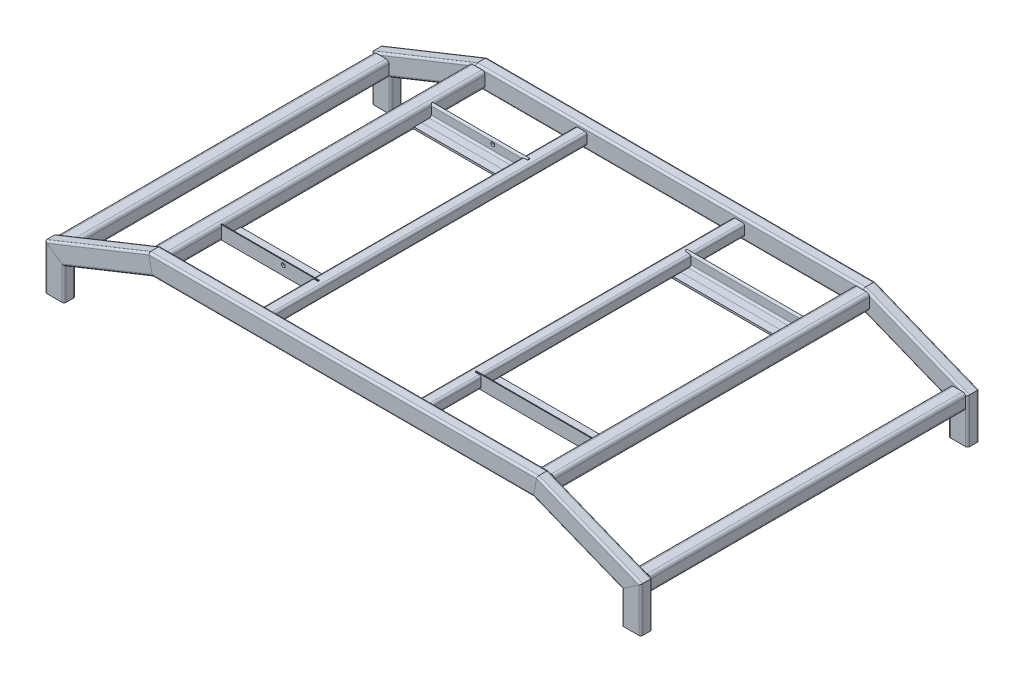
from build123d import *

# Parameters (mm, degrees)
RECTANGULAR_TUBE_CONFIGURED_50_X_30_X_DEPTH      = 120.738733147
RECTANGULAR_TUBE_CONFIGURED_50_X_3_3_DEPTH       = 296.611667158
RECTANGULAR_TUBE_CONFIGURED_50_X_3_5_DEPTH       = 1013.22938731
RECTANGULAR_TUBE_CONFIGURED_50_X_3_7_DEPTH       = 296.611667158
RECTANGULAR_TUBE_CONFIGURED_50_X_3_9_DEPTH       = 100
RECTANGULAR_TUBE_CONFIGURED_50_X_3_9_DEPTH_BACK  = 20.738733147
RECTANGULAR_TUBE_CONFIGURED_50_X_3_10_DEPTH      = 120.738733147
RECTANGULAR_TUBE_CONFIGURED_50_X_3_12_DEPTH      = 296.611667158
RECTANGULAR_TUBE_CONFIGURED_50_X_3_15_DEPTH      = 1013.22938731
RECTANGULAR_TUBE_CONFIGURED_50_X_3_18_DEPTH      = 296.611667158
RECTANGULAR_TUBE_CONFIGURED_50_X_3_21_DEPTH      = 100
RECTANGULAR_TUBE_CONFIGURED_50_X_3_21_DEPTH_BACK = 20.738733147
SQUARE_TUBE_CONFIGURED_40_X_40_X_4_1_DEPTH       = 850
SQUARE_TUBE_CONFIGURED_40_X_40_X_4_1_2_DEPTH     = 850
SQUARE_TUBE_CONFIGURED_40_X_40_X_4_1_3_DEPTH     = 850
SQUARE_TUBE_CONFIGURED_40_X_40_X_4_1_4_DEPTH     = 850
ANGLE_START                                      = -500
ANGLE_IRON_CONFIGURED_35_X_35_X_5_1_DEPTH        = 1000
ANGLE_IRON_CONFIGURED_35_X_35_X_5_1_2_DEPTH      = 1000
TRIM_EXTEND2_START                               = -701
TRIM_EXTEND2_DEPTH                               = 37
TRIM_EXTEND2_START_2                             = -186
TRIM_EXTEND2_2_DEPTH                             = 37
CUT_EXTRUDE1_START                               = -140
SKETCH18_R                                       = 5
CUT_EXTRUDE1_DEPTH                               = 820
BOSS_EXTRUDE1_START                              = -3
BOSS_EXTRUDE1_DEPTH                              = 966
CUT_EXTRUDE2_DEPTH                               = 1177.437949986
CUT_EXTRUDE2_DEPTH_BACK                          = 1177.437949986
SKETCH20_W                                       = 410.015640289
SKETCH20_H                                       = 675.38858568
SQUARE_TUBE_CONFIGURED_30_X_30_X_2_6_1_DEPTH     = 850
SQUARE_TUBE_CONFIGURED_30_X_30_X_2_2_DEPTH       = 850


with BuildPart() as part:
    # Sketch11 on segment 1 (carried to segment 1) → Rectangular tube - configured 50 X 30 X (new body)
    with BuildSketch(Plane(origin=(-750, -100, 0), x_dir=(0, 0, 1), z_dir=(0, 1, 0))):
        with BuildLine():
            Line((-9.8, -25), (9.8, -25))
            ThreePointArc((9.8, -25), (13.476955262, -23.476955262), (15, -19.8))
            Line((15, -19.8), (15, 19.8))
            ThreePointArc((15, 19.8), (13.476955262, 23.476955262), (9.8, 25))
            Line((9.8, 25), (-9.8, 25))
            ThreePointArc((-9.8, 25), (-13.476955262, 23.476955262), (-15, 19.8))
            Line((-15, 19.8), (-15, -19.8))
            ThreePointArc((-15, -19.8), (-13.476955262, -23.476955262), (-9.8, -25))
        make_face()
        with BuildLine():
            Line((-9.8, -22.4), (9.8, -22.4))
            ThreePointArc((9.8, -22.4), (11.638477631, -21.638477631), (12.4, -19.8))
            Line((12.4, -19.8), (12.4, 19.8))
            ThreePointArc((12.4, 19.8), (11.638477631, 21.638477631), (9.8, 22.4))
            Line((9.8, 22.4), (-9.8, 22.4))
            ThreePointArc((-9.8, 22.4), (-11.638477631, 21.638477631), (-12.4, 19.8))
            Line((-12.4, 19.8), (-12.4, -19.8))
            ThreePointArc((-12.4, -19.8), (-11.638477631, -21.638477631), (-9.8, -22.4))
        make_face(mode=Mode.SUBTRACT)
    extrude(amount=RECTANGULAR_TUBE_CONFIGURED_50_X_30_X_DEPTH)

    # Rectangular tube - configured 50 X 3 2
    split(bisect_by=Plane(origin=(-750, 0, 0), x_dir=(0.82806723, -0.560628809, 0), z_dir=(-0.560628809, -0.82806723, 0)), keep=Keep.TOP)


with BuildPart() as body_2:
    # Sketch11 on segment 2 (carried to segment 2) → Rectangular tube - configured 50 X 3 3 (new body)
    with BuildSketch(Plane(origin=(-769.255430325, -7.70217213, 0), x_dir=(0, 0, 1), z_dir=(0.928476691, 0.371390676, 0))):
        with BuildLine():
            Line((-9.8, -25), (9.8, -25))
            ThreePointArc((9.8, -25), (13.476955262, -23.476955262), (15, -19.8))
            Line((15, -19.8), (15, 19.8))
            ThreePointArc((15, 19.8), (13.476955262, 23.476955262), (9.8, 25))
            Line((9.8, 25), (-9.8, 25))
            ThreePointArc((-9.8, 25), (-13.476955262, 23.476955262), (-15, 19.8))
            Line((-15, 19.8), (-15, -19.8))
            ThreePointArc((-15, -19.8), (-13.476955262, -23.476955262), (-9.8, -25))
        make_face()
        with BuildLine():
            Line((-9.8, -22.4), (9.8, -22.4))
            ThreePointArc((9.8, -22.4), (11.638477631, -21.638477631), (12.4, -19.8))
            Line((12.4, -19.8), (12.4, 19.8))
            ThreePointArc((12.4, 19.8), (11.638477631, 21.638477631), (9.8, 22.4))
            Line((9.8, 22.4), (-9.8, 22.4))
            ThreePointArc((-9.8, 22.4), (-11.638477631, 21.638477631), (-12.4, 19.8))
            Line((-12.4, 19.8), (-12.4, -19.8))
            ThreePointArc((-12.4, -19.8), (-11.638477631, -21.638477631), (-9.8, -22.4))
        make_face(mode=Mode.SUBTRACT)
    extrude(amount=RECTANGULAR_TUBE_CONFIGURED_50_X_3_3_DEPTH)

    # Rectangular tube - configured 50 X 3 3 m
    split(bisect_by=Plane(origin=(-750, 0, 0), x_dir=(-0.82806723, 0.560628809, 0), z_dir=(0.560628809, 0.82806723, 0)), keep=Keep.TOP)

    # Rectangular tube - configured 50 X 3 4
    split(bisect_by=Plane(origin=(-500, 100, 0), x_dir=(0.189107521, -0.981956387, 0), z_dir=(-0.981956387, -0.189107521, 0)), keep=Keep.TOP)


with BuildPart() as body_3:
    # Sketch11 on segment 3 (carried to segment 3) → Rectangular tube - configured 50 X 3 5 (new body)
    with BuildSketch(Plane(origin=(-506.614693655, 100, 0), x_dir=(0, 0, 1), z_dir=(1, 0, 0))):
        with BuildLine():
            Line((-9.8, -25), (9.8, -25))
            ThreePointArc((9.8, -25), (13.476955262, -23.476955262), (15, -19.8))
            Line((15, -19.8), (15, 19.8))
            ThreePointArc((15, 19.8), (13.476955262, 23.476955262), (9.8, 25))
            Line((9.8, 25), (-9.8, 25))
            ThreePointArc((-9.8, 25), (-13.476955262, 23.476955262), (-15, 19.8))
            Line((-15, 19.8), (-15, -19.8))
            ThreePointArc((-15, -19.8), (-13.476955262, -23.476955262), (-9.8, -25))
        make_face()
        with BuildLine():
            Line((-9.8, -22.4), (9.8, -22.4))
            ThreePointArc((9.8, -22.4), (11.638477631, -21.638477631), (12.4, -19.8))
            Line((12.4, -19.8), (12.4, 19.8))
            ThreePointArc((12.4, 19.8), (11.638477631, 21.638477631), (9.8, 22.4))
            Line((9.8, 22.4), (-9.8, 22.4))
            ThreePointArc((-9.8, 22.4), (-11.638477631, 21.638477631), (-12.4, 19.8))
            Line((-12.4, 19.8), (-12.4, -19.8))
            ThreePointArc((-12.4, -19.8), (-11.638477631, -21.638477631), (-9.8, -22.4))
        make_face(mode=Mode.SUBTRACT)
    extrude(amount=RECTANGULAR_TUBE_CONFIGURED_50_X_3_5_DEPTH)

    # Rectangular tube - configured 50 X 3 5 m
    split(bisect_by=Plane(origin=(-500, 100, 0), x_dir=(-0.189107521, 0.981956387, 0), z_dir=(0.981956387, 0.189107521, 0)), keep=Keep.TOP)

    # Rectangular tube - configured 50 X 3 6
    split(bisect_by=Plane(origin=(500, 100, 0), x_dir=(-0.189107521, -0.981956387, 0), z_dir=(-0.981956387, 0.189107521, 0)), keep=Keep.TOP)


with BuildPart() as body_4:
    # Sketch11 on segment 4 (carried to segment 4) → Rectangular tube - configured 50 X 3 7 (new body)
    with BuildSketch(Plane(origin=(493.858411124, 102.45663555, 0), x_dir=(0, 0, 1), z_dir=(0.928476691, -0.371390676, 0))):
        with BuildLine():
            Line((-9.8, -25), (9.8, -25))
            ThreePointArc((9.8, -25), (13.476955262, -23.476955262), (15, -19.8))
            Line((15, -19.8), (15, 19.8))
            ThreePointArc((15, 19.8), (13.476955262, 23.476955262), (9.8, 25))
            Line((9.8, 25), (-9.8, 25))
            ThreePointArc((-9.8, 25), (-13.476955262, 23.476955262), (-15, 19.8))
            Line((-15, 19.8), (-15, -19.8))
            ThreePointArc((-15, -19.8), (-13.476955262, -23.476955262), (-9.8, -25))
        make_face()
        with BuildLine():
            Line((-9.8, -22.4), (9.8, -22.4))
            ThreePointArc((9.8, -22.4), (11.638477631, -21.638477631), (12.4, -19.8))
            Line((12.4, -19.8), (12.4, 19.8))
            ThreePointArc((12.4, 19.8), (11.638477631, 21.638477631), (9.8, 22.4))
            Line((9.8, 22.4), (-9.8, 22.4))
            ThreePointArc((-9.8, 22.4), (-11.638477631, 21.638477631), (-12.4, 19.8))
            Line((-12.4, 19.8), (-12.4, -19.8))
            ThreePointArc((-12.4, -19.8), (-11.638477631, -21.638477631), (-9.8, -22.4))
        make_face(mode=Mode.SUBTRACT)
    extrude(amount=RECTANGULAR_TUBE_CONFIGURED_50_X_3_7_DEPTH)

    # Rectangular tube - configured 50 X 3 7 m
    split(bisect_by=Plane(origin=(500, 100, 0), x_dir=(0.189107521, 0.981956387, 0), z_dir=(0.981956387, -0.189107521, 0)), keep=Keep.TOP)

    # Rectangular tube - configured 50 X 3 8
    split(bisect_by=Plane(origin=(750, 0, 0), x_dir=(-0.82806723, -0.560628809, 0), z_dir=(-0.560628809, 0.82806723, 0)), keep=Keep.TOP)


with BuildPart() as body_5:
    # Sketch11 → Rectangular tube - configured 50 X 3 9 (new, two sides: drawn at the far end of the back side and taken through both)
    with BuildSketch(Plane(origin=(750, 0, 0), x_dir=(0, 0, 1), z_dir=(0, -1, 0)).offset(-RECTANGULAR_TUBE_CONFIGURED_50_X_3_9_DEPTH_BACK)):
        with BuildLine():
            Line((-9.8, -25), (9.8, -25))
            ThreePointArc((9.8, -25), (13.476955262, -23.476955262), (15, -19.8))
            Line((15, -19.8), (15, 19.8))
            ThreePointArc((15, 19.8), (13.476955262, 23.476955262), (9.8, 25))
            Line((9.8, 25), (-9.8, 25))
            ThreePointArc((-9.8, 25), (-13.476955262, 23.476955262), (-15, 19.8))
            Line((-15, 19.8), (-15, -19.8))
            ThreePointArc((-15, -19.8), (-13.476955262, -23.476955262), (-9.8, -25))
        make_face()
        with BuildLine():
            Line((-9.8, -22.4), (9.8, -22.4))
            ThreePointArc((9.8, -22.4), (11.638477631, -21.638477631), (12.4, -19.8))
            Line((12.4, -19.8), (12.4, 19.8))
            ThreePointArc((12.4, 19.8), (11.638477631, 21.638477631), (9.8, 22.4))
            Line((9.8, 22.4), (-9.8, 22.4))
            ThreePointArc((-9.8, 22.4), (-11.638477631, 21.638477631), (-12.4, 19.8))
            Line((-12.4, 19.8), (-12.4, -19.8))
            ThreePointArc((-12.4, -19.8), (-11.638477631, -21.638477631), (-9.8, -22.4))
        make_face(mode=Mode.SUBTRACT)
    extrude(amount=RECTANGULAR_TUBE_CONFIGURED_50_X_3_9_DEPTH + RECTANGULAR_TUBE_CONFIGURED_50_X_3_9_DEPTH_BACK)

    # Rectangular tube - configured 50 X 3 9 m
    split(bisect_by=Plane(origin=(750, 0, 0), x_dir=(0.82806723, 0.560628809, 0), z_dir=(0.560628809, -0.82806723, 0)), keep=Keep.TOP)


with BuildPart() as body_6:
    # Sketch12 on segment 1 (carried to segment 1) → Rectangular tube - configured 50 X 3 10 (new body)
    with BuildSketch(Plane(origin=(-750, -100, -850), x_dir=(0, 0, 1), z_dir=(0, 1, 0))):
        with BuildLine():
            Line((-9.8, -25), (9.8, -25))
            ThreePointArc((9.8, -25), (13.476955262, -23.476955262), (15, -19.8))
            Line((15, -19.8), (15, 19.8))
            ThreePointArc((15, 19.8), (13.476955262, 23.476955262), (9.8, 25))
            Line((9.8, 25), (-9.8, 25))
            ThreePointArc((-9.8, 25), (-13.476955262, 23.476955262), (-15, 19.8))
            Line((-15, 19.8), (-15, -19.8))
            ThreePointArc((-15, -19.8), (-13.476955262, -23.476955262), (-9.8, -25))
        make_face()
        with BuildLine():
            Line((-9.8, -22.4), (9.8, -22.4))
            ThreePointArc((9.8, -22.4), (11.638477631, -21.638477631), (12.4, -19.8))
            Line((12.4, -19.8), (12.4, 19.8))
            ThreePointArc((12.4, 19.8), (11.638477631, 21.638477631), (9.8, 22.4))
            Line((9.8, 22.4), (-9.8, 22.4))
            ThreePointArc((-9.8, 22.4), (-11.638477631, 21.638477631), (-12.4, 19.8))
            Line((-12.4, 19.8), (-12.4, -19.8))
            ThreePointArc((-12.4, -19.8), (-11.638477631, -21.638477631), (-9.8, -22.4))
        make_face(mode=Mode.SUBTRACT)
    extrude(amount=RECTANGULAR_TUBE_CONFIGURED_50_X_3_10_DEPTH)

    # Rectangular tube - configured 50 X 3 11
    split(bisect_by=Plane(origin=(-750, 0, -850), x_dir=(0.82806723, -0.560628809, 0), z_dir=(-0.560628809, -0.82806723, 0)), keep=Keep.TOP)


with BuildPart() as body_7:
    # Sketch12 on segment 2 (carried to segment 2) → Rectangular tube - configured 50 X 3 12 (new body)
    with BuildSketch(Plane(origin=(-769.255430325, -7.70217213, -850), x_dir=(0, 0, 1), z_dir=(0.928476691, 0.371390676, 0))):
        with BuildLine():
            Line((-9.8, -25), (9.8, -25))
            ThreePointArc((9.8, -25), (13.476955262, -23.476955262), (15, -19.8))
            Line((15, -19.8), (15, 19.8))
            ThreePointArc((15, 19.8), (13.476955262, 23.476955262), (9.8, 25))
            Line((9.8, 25), (-9.8, 25))
            ThreePointArc((-9.8, 25), (-13.476955262, 23.476955262), (-15, 19.8))
            Line((-15, 19.8), (-15, -19.8))
            ThreePointArc((-15, -19.8), (-13.476955262, -23.476955262), (-9.8, -25))
        make_face()
        with BuildLine():
            Line((-9.8, -22.4), (9.8, -22.4))
            ThreePointArc((9.8, -22.4), (11.638477631, -21.638477631), (12.4, -19.8))
            Line((12.4, -19.8), (12.4, 19.8))
            ThreePointArc((12.4, 19.8), (11.638477631, 21.638477631), (9.8, 22.4))
            Line((9.8, 22.4), (-9.8, 22.4))
            ThreePointArc((-9.8, 22.4), (-11.638477631, 21.638477631), (-12.4, 19.8))
            Line((-12.4, 19.8), (-12.4, -19.8))
            ThreePointArc((-12.4, -19.8), (-11.638477631, -21.638477631), (-9.8, -22.4))
        make_face(mode=Mode.SUBTRACT)
    extrude(amount=RECTANGULAR_TUBE_CONFIGURED_50_X_3_12_DEPTH)

    # Rectangular tube - configured 50 X 3 13
    split(bisect_by=Plane(origin=(-750, 0, -850), x_dir=(-0.82806723, 0.560628809, 0), z_dir=(0.560628809, 0.82806723, 0)), keep=Keep.TOP)

    # Rectangular tube - configured 50 X 3 14
    split(bisect_by=Plane(origin=(-500, 100, -850), x_dir=(0.189107521, -0.981956387, 0), z_dir=(-0.981956387, -0.189107521, 0)), keep=Keep.TOP)


with BuildPart() as body_8:
    # Sketch12 on segment 3 (carried to segment 3) → Rectangular tube - configured 50 X 3 15 (new body)
    with BuildSketch(Plane(origin=(-506.614693655, 100, -850), x_dir=(0, 0, 1), z_dir=(1, 0, 0))):
        with BuildLine():
            Line((-9.8, -25), (9.8, -25))
            ThreePointArc((9.8, -25), (13.476955262, -23.476955262), (15, -19.8))
            Line((15, -19.8), (15, 19.8))
            ThreePointArc((15, 19.8), (13.476955262, 23.476955262), (9.8, 25))
            Line((9.8, 25), (-9.8, 25))
            ThreePointArc((-9.8, 25), (-13.476955262, 23.476955262), (-15, 19.8))
            Line((-15, 19.8), (-15, -19.8))
            ThreePointArc((-15, -19.8), (-13.476955262, -23.476955262), (-9.8, -25))
        make_face()
        with BuildLine():
            Line((-9.8, -22.4), (9.8, -22.4))
            ThreePointArc((9.8, -22.4), (11.638477631, -21.638477631), (12.4, -19.8))
            Line((12.4, -19.8), (12.4, 19.8))
            ThreePointArc((12.4, 19.8), (11.638477631, 21.638477631), (9.8, 22.4))
            Line((9.8, 22.4), (-9.8, 22.4))
            ThreePointArc((-9.8, 22.4), (-11.638477631, 21.638477631), (-12.4, 19.8))
            Line((-12.4, 19.8), (-12.4, -19.8))
            ThreePointArc((-12.4, -19.8), (-11.638477631, -21.638477631), (-9.8, -22.4))
        make_face(mode=Mode.SUBTRACT)
    extrude(amount=RECTANGULAR_TUBE_CONFIGURED_50_X_3_15_DEPTH)

    # Rectangular tube - configured 50 X 3 16
    split(bisect_by=Plane(origin=(-500, 100, -850), x_dir=(-0.189107521, 0.981956387, 0), z_dir=(0.981956387, 0.189107521, 0)), keep=Keep.TOP)

    # Rectangular tube - configured 50 X 3 17
    split(bisect_by=Plane(origin=(500, 100, -850), x_dir=(-0.189107521, -0.981956387, 0), z_dir=(-0.981956387, 0.189107521, 0)), keep=Keep.TOP)


with BuildPart() as body_9:
    # Sketch12 on segment 4 (carried to segment 4) → Rectangular tube - configured 50 X 3 18 (new body)
    with BuildSketch(Plane(origin=(493.858411124, 102.45663555, -850), x_dir=(0, 0, 1), z_dir=(0.928476691, -0.371390676, 0))):
        with BuildLine():
            Line((-9.8, -25), (9.8, -25))
            ThreePointArc((9.8, -25), (13.476955262, -23.476955262), (15, -19.8))
            Line((15, -19.8), (15, 19.8))
            ThreePointArc((15, 19.8), (13.476955262, 23.476955262), (9.8, 25))
            Line((9.8, 25), (-9.8, 25))
            ThreePointArc((-9.8, 25), (-13.476955262, 23.476955262), (-15, 19.8))
            Line((-15, 19.8), (-15, -19.8))
            ThreePointArc((-15, -19.8), (-13.476955262, -23.476955262), (-9.8, -25))
        make_face()
        with BuildLine():
            Line((-9.8, -22.4), (9.8, -22.4))
            ThreePointArc((9.8, -22.4), (11.638477631, -21.638477631), (12.4, -19.8))
            Line((12.4, -19.8), (12.4, 19.8))
            ThreePointArc((12.4, 19.8), (11.638477631, 21.638477631), (9.8, 22.4))
            Line((9.8, 22.4), (-9.8, 22.4))
            ThreePointArc((-9.8, 22.4), (-11.638477631, 21.638477631), (-12.4, 19.8))
            Line((-12.4, 19.8), (-12.4, -19.8))
            ThreePointArc((-12.4, -19.8), (-11.638477631, -21.638477631), (-9.8, -22.4))
        make_face(mode=Mode.SUBTRACT)
    extrude(amount=RECTANGULAR_TUBE_CONFIGURED_50_X_3_18_DEPTH)

    # Rectangular tube - configured 50 X 3 19
    split(bisect_by=Plane(origin=(500, 100, -850), x_dir=(0.189107521, 0.981956387, 0), z_dir=(0.981956387, -0.189107521, 0)), keep=Keep.TOP)

    # Rectangular tube - configured 50 X 3 20
    split(bisect_by=Plane(origin=(750, 0, -850), x_dir=(-0.82806723, -0.560628809, 0), z_dir=(-0.560628809, 0.82806723, 0)), keep=Keep.TOP)


with BuildPart() as body_10:
    # Sketch12 → Rectangular tube - configured 50 X 3 21 (new, two sides: drawn at the far end of the back side and taken through both)
    with BuildSketch(Plane(origin=(750, 0, -850), x_dir=(0, 0, 1), z_dir=(0, -1, 0)).offset(-RECTANGULAR_TUBE_CONFIGURED_50_X_3_21_DEPTH_BACK)):
        with BuildLine():
            Line((-9.8, -25), (9.8, -25))
            ThreePointArc((9.8, -25), (13.476955262, -23.476955262), (15, -19.8))
            Line((15, -19.8), (15, 19.8))
            ThreePointArc((15, 19.8), (13.476955262, 23.476955262), (9.8, 25))
            Line((9.8, 25), (-9.8, 25))
            ThreePointArc((-9.8, 25), (-13.476955262, 23.476955262), (-15, 19.8))
            Line((-15, 19.8), (-15, -19.8))
            ThreePointArc((-15, -19.8), (-13.476955262, -23.476955262), (-9.8, -25))
        make_face()
        with BuildLine():
            Line((-9.8, -22.4), (9.8, -22.4))
            ThreePointArc((9.8, -22.4), (11.638477631, -21.638477631), (12.4, -19.8))
            Line((12.4, -19.8), (12.4, 19.8))
            ThreePointArc((12.4, 19.8), (11.638477631, 21.638477631), (9.8, 22.4))
            Line((9.8, 22.4), (-9.8, 22.4))
            ThreePointArc((-9.8, 22.4), (-11.638477631, 21.638477631), (-12.4, 19.8))
            Line((-12.4, 19.8), (-12.4, -19.8))
            ThreePointArc((-12.4, -19.8), (-11.638477631, -21.638477631), (-9.8, -22.4))
        make_face(mode=Mode.SUBTRACT)
    extrude(amount=RECTANGULAR_TUBE_CONFIGURED_50_X_3_21_DEPTH + RECTANGULAR_TUBE_CONFIGURED_50_X_3_21_DEPTH_BACK)

    # Rectangular tube - configured 50 X 3 22
    split(bisect_by=Plane(origin=(750, 0, -850), x_dir=(0.82806723, 0.560628809, 0), z_dir=(0.560628809, -0.82806723, 0)), keep=Keep.TOP)


with BuildPart() as body_11:
    # Sketch16 → Square tube - configured 40 X 40 X 4(1) (new body)
    with BuildSketch(Plane(origin=(-750, 0, 0), x_dir=(1, 0, 0), z_dir=(0, 0, -1))):
        with BuildLine():
            Line((-12, -20), (12, -20))
            ThreePointArc((12, -20), (17.656854249, -17.656854249), (20, -12))
            Line((20, -12), (20, 12))
            ThreePointArc((20, 12), (17.656854249, 17.656854249), (12, 20))
            Line((12, 20), (-12, 20))
            ThreePointArc((-12, 20), (-17.656854249, 17.656854249), (-20, 12))
            Line((-20, 12), (-20, -12))
            ThreePointArc((-20, -12), (-17.656854249, -17.656854249), (-12, -20))
        make_face()
        with BuildLine():
            Line((-12, -16), (12, -16))
            ThreePointArc((12, -16), (14.828427125, -14.828427125), (16, -12))
            Line((16, -12), (16, 12))
            ThreePointArc((16, 12), (14.828427125, 14.828427125), (12, 16))
            Line((12, 16), (-12, 16))
            ThreePointArc((-12, 16), (-14.828427125, 14.828427125), (-16, 12))
            Line((-16, 12), (-16, -12))
            ThreePointArc((-16, -12), (-14.828427125, -14.828427125), (-12, -16))
        make_face(mode=Mode.SUBTRACT)
    extrude(amount=SQUARE_TUBE_CONFIGURED_40_X_40_X_4_1_DEPTH)

    # Trim/Extend1
    split(bisect_by=Plane(origin=(0, 100.050333337, -15), x_dir=(0, 1, 0), z_dir=(0, 0, -1)), keep=Keep.TOP)

    # Trim_Extend1 224
    split(bisect_by=Plane(origin=(0, 100.050333337, -835), x_dir=(0, -1, 0), z_dir=(0, 0, 1)), keep=Keep.TOP)


with BuildPart() as body_12:
    # Sketch16 on segment 2 (carried to segment 2) → Square tube - configured 40 X 40 X 4_1 2 (new body)
    with BuildSketch(Plane(origin=(-500, 100, 0), x_dir=(1, 0, 0), z_dir=(0, 0, -1))):
        with BuildLine():
            Line((-12, -20), (12, -20))
            ThreePointArc((12, -20), (17.656854249, -17.656854249), (20, -12))
            Line((20, -12), (20, 12))
            ThreePointArc((20, 12), (17.656854249, 17.656854249), (12, 20))
            Line((12, 20), (-12, 20))
            ThreePointArc((-12, 20), (-17.656854249, 17.656854249), (-20, 12))
            Line((-20, 12), (-20, -12))
            ThreePointArc((-20, -12), (-17.656854249, -17.656854249), (-12, -20))
        make_face()
        with BuildLine():
            Line((-12, -16), (12, -16))
            ThreePointArc((12, -16), (14.828427125, -14.828427125), (16, -12))
            Line((16, -12), (16, 12))
            ThreePointArc((16, 12), (14.828427125, 14.828427125), (12, 16))
            Line((12, 16), (-12, 16))
            ThreePointArc((-12, 16), (-14.828427125, 14.828427125), (-16, 12))
            Line((-16, 12), (-16, -12))
            ThreePointArc((-16, -12), (-14.828427125, -14.828427125), (-12, -16))
        make_face(mode=Mode.SUBTRACT)
    extrude(amount=SQUARE_TUBE_CONFIGURED_40_X_40_X_4_1_2_DEPTH)

    # Trim/Extend1
    split(bisect_by=Plane(origin=(0, 100.050333337, -15), x_dir=(0, 1, 0), z_dir=(0, 0, -1)), keep=Keep.TOP)

    # Trim_Extend1 224
    split(bisect_by=Plane(origin=(0, 100.050333337, -835), x_dir=(0, -1, 0), z_dir=(0, 0, 1)), keep=Keep.TOP)



with BuildPart() as body_13:
    # Sketch16 on segment 3 (carried to segment 3) → Square tube - configured 40 X 40 X 4_1 3 (new body)
    with BuildSketch(Plane(origin=(500, 100, 0), x_dir=(1, 0, 0), z_dir=(0, 0, -1))):
        with BuildLine():
            Line((-12, -20), (12, -20))
            ThreePointArc((12, -20), (17.656854249, -17.656854249), (20, -12))
            Line((20, -12), (20, 12))
            ThreePointArc((20, 12), (17.656854249, 17.656854249), (12, 20))
            Line((12, 20), (-12, 20))
            ThreePointArc((-12, 20), (-17.656854249, 17.656854249), (-20, 12))
            Line((-20, 12), (-20, -12))
            ThreePointArc((-20, -12), (-17.656854249, -17.656854249), (-12, -20))
        make_face()
        with BuildLine():
            Line((-12, -16), (12, -16))
            ThreePointArc((12, -16), (14.828427125, -14.828427125), (16, -12))
            Line((16, -12), (16, 12))
            ThreePointArc((16, 12), (14.828427125, 14.828427125), (12, 16))
            Line((12, 16), (-12, 16))
            ThreePointArc((-12, 16), (-14.828427125, 14.828427125), (-16, 12))
            Line((-16, 12), (-16, -12))
            ThreePointArc((-16, -12), (-14.828427125, -14.828427125), (-12, -16))
        make_face(mode=Mode.SUBTRACT)
    extrude(amount=SQUARE_TUBE_CONFIGURED_40_X_40_X_4_1_3_DEPTH)

    # Trim/Extend1
    split(bisect_by=Plane(origin=(0, 100.050333337, -15), x_dir=(0, 1, 0), z_dir=(0, 0, -1)), keep=Keep.TOP)

    # Trim_Extend1 224
    split(bisect_by=Plane(origin=(0, 100.050333337, -835), x_dir=(0, -1, 0), z_dir=(0, 0, 1)), keep=Keep.TOP)


with BuildPart() as body_14:
    # Sketch16 on segment 4 (carried to segment 4) → Square tube - configured 40 X 40 X 4_1 4 (new body)
    with BuildSketch(Plane(origin=(750, 0, 0), x_dir=(1, 0, 0), z_dir=(0, 0, -1))):
        with BuildLine():
            Line((-12, -20), (12, -20))
            ThreePointArc((12, -20), (17.656854249, -17.656854249), (20, -12))
            Line((20, -12), (20, 12))
            ThreePointArc((20, 12), (17.656854249, 17.656854249), (12, 20))
            Line((12, 20), (-12, 20))
            ThreePointArc((-12, 20), (-17.656854249, 17.656854249), (-20, 12))
            Line((-20, 12), (-20, -12))
            ThreePointArc((-20, -12), (-17.656854249, -17.656854249), (-12, -20))
        make_face()
        with BuildLine():
            Line((-12, -16), (12, -16))
            ThreePointArc((12, -16), (14.828427125, -14.828427125), (16, -12))
            Line((16, -12), (16, 12))
            ThreePointArc((16, 12), (14.828427125, 14.828427125), (12, 16))
            Line((12, 16), (-12, 16))
            ThreePointArc((-12, 16), (-14.828427125, 14.828427125), (-16, 12))
            Line((-16, 12), (-16, -12))
            ThreePointArc((-16, -12), (-14.828427125, -14.828427125), (-12, -16))
        make_face(mode=Mode.SUBTRACT)
    extrude(amount=SQUARE_TUBE_CONFIGURED_40_X_40_X_4_1_4_DEPTH)

    # Trim/Extend1
    split(bisect_by=Plane(origin=(0, 100.050333337, -15), x_dir=(0, 1, 0), z_dir=(0, 0, -1)), keep=Keep.TOP)

    # Trim_Extend1 224
    split(bisect_by=Plane(origin=(0, 100.050333337, -835), x_dir=(0, -1, 0), z_dir=(0, 0, 1)), keep=Keep.TOP)


with BuildPart() as body_15:
    # Angle iron - configured 35 X 35 X 5(1): read off the stored shape, not the designer's step
    # Angle iron - configured 35 X 35 X 5(1) ou → Angle iron - configured 35 X 35 X 5(1) (new body)
    with BuildSketch(Plane.YZ.offset(ANGLE_START)):
        with BuildLine():
            Line((82.5, -700), (117.5, -700))
            ThreePointArc((117.5, -700), (116.035533906, -696.464466094), (112.5, -695))
            Line((112.5, -695), (92.5, -695))
            ThreePointArc((92.5, -695), (88.964466094, -693.535533906), (87.5, -690))
            Line((87.5, -690), (87.5, -670))
            ThreePointArc((87.5, -670), (86.035533906, -666.464466094), (82.5, -665))
            Line((82.5, -665), (82.5, -700))
        make_face()
    extrude(amount=ANGLE_IRON_CONFIGURED_35_X_35_X_5_1_DEPTH)

    # Trim/Extend2: read off the stored shape, not the designer's step
    # Trim/Extend2 outline → Trim/Extend2 (cut)
    with BuildSketch(Plane.XY.offset(TRIM_EXTEND2_START)):
        with BuildLine():
            Line((480, 112), (480, 88.000013415))
            ThreePointArc((480, 88.000013415), (480.567777118, 85.039921786), (482.190524981, 82.5))
            Line((482.190524981, 82.5), (483.610618875, 81))
            Line((483.610618875, 81), (500, 81))
            Line((500, 81), (500, 119))
            Line((500, 119), (483.610618874, 119))
            Line((483.610618874, 119), (482.190524981, 117.5))
            ThreePointArc((482.190524981, 117.5), (480.5677796, 114.960084445), (480, 112))
        make_face()
        with BuildLine():
            Line((-500, 81), (-483.610618875, 81))
            Line((-483.610618875, 81), (-482.190524981, 82.5))
            ThreePointArc((-482.190524981, 82.5), (-480.567779502, 85.039915801), (-480, 88.000000531))
            Line((-480, 88.000000531), (-480, 112))
            ThreePointArc((-480, 112), (-480.5677796, 114.960084445), (-482.190524981, 117.5))
            Line((-482.190524981, 117.5), (-483.610618874, 119))
            Line((-483.610618874, 119), (-500, 119))
            Line((-500, 119), (-500, 81))
        make_face()
    extrude(amount=TRIM_EXTEND2_DEPTH, mode=Mode.SUBTRACT)


with BuildPart() as body_16:
    # Angle iron - configured 35 X 35 X 5_ 2 → Angle iron - configured 35 X 35 X 5_1 2 (new body)
    with BuildSketch(Plane.YZ.offset(ANGLE_START)):
        with BuildLine():
            Line((82.5, -150), (82.5, -185))
            ThreePointArc((82.5, -185), (86.035533906, -183.535533906), (87.5, -180))
            Line((87.5, -180), (87.5, -160))
            ThreePointArc((87.5, -160), (88.964466094, -156.464466094), (92.5, -155))
            Line((92.5, -155), (112.5, -155))
            ThreePointArc((112.5, -155), (116.035533906, -153.535533906), (117.5, -150))
            Line((117.5, -150), (82.5, -150))
        make_face()
    extrude(amount=ANGLE_IRON_CONFIGURED_35_X_35_X_5_1_2_DEPTH)

    # Trim_Extend2 2 outline → Trim_Extend2 2 (cut)
    with BuildSketch(Plane.XY.offset(TRIM_EXTEND2_START_2)):
        with BuildLine():
            Line((480, 112), (480, 88))
            ThreePointArc((480, 88), (480.5677796, 85.039915555), (482.190524981, 82.5))
            Line((482.190524981, 82.5), (483.610618874, 81))
            Line((483.610618874, 81), (500, 81))
            Line((500, 81), (500, 119))
            Line((500, 119), (483.610618874, 119))
            Line((483.610618874, 119), (482.190524981, 117.5))
            ThreePointArc((482.190524981, 117.5), (480.5677796, 114.960084445), (480, 112))
        make_face()
        with BuildLine():
            Line((-500, 81), (-483.610618874, 81))
            Line((-483.610618874, 81), (-482.190524981, 82.5))
            ThreePointArc((-482.190524981, 82.5), (-480.5677796, 85.039915555), (-480, 88))
            Line((-480, 88), (-480, 112))
            ThreePointArc((-480, 112), (-480.5677796, 114.960084445), (-482.190524981, 117.5))
            Line((-482.190524981, 117.5), (-483.610618874, 119))
            Line((-483.610618874, 119), (-500, 119))
            Line((-500, 119), (-500, 81))
        make_face()
    extrude(amount=TRIM_EXTEND2_2_DEPTH, mode=Mode.SUBTRACT)


with BuildPart() as cut_extrude1_tool:
    # Sketch18 → Cut-Extrude1 (new body)
    with BuildSketch(Plane(origin=(0, 0, -155), x_dir=(-1, 0, 0), z_dir=(0, 0, -1)).offset(CUT_EXTRUDE1_START)):
        with Locations(Location((320, 106.5, 0), (0, 0, 270))):
            Circle(SKETCH18_R)
    extrude(amount=CUT_EXTRUDE1_DEPTH)


with BuildPart() as body_15_1:
    add(body_15.part)

    # Cut-Extrude1: cut by cut_extrude1_tool
    add(cut_extrude1_tool.part, mode=Mode.SUBTRACT)


with BuildPart() as body_16_1:
    add(body_16.part)

    # Cut-Extrude1: cut by cut_extrude1_tool
    add(cut_extrude1_tool.part, mode=Mode.SUBTRACT)


with BuildPart() as body_12_1:
    add(body_12.part)

    add(body_13.part)  # Boss-Extrude1 merges body 13

    add(body_16_1.part)  # Boss-Extrude1 merges body 16
    # Boss-Extrude1: read off the stored shape, not the designer's step
    # Boss-Extrude1 outline → Boss-Extrude1 (add)
    with BuildSketch(Plane(origin=(-480, 0, 0), x_dir=(0, 0, -1), z_dir=(1, 0, 0)).offset(BOSS_EXTRUDE1_START)):
        with BuildLine():
            ThreePointArc((180, 87.5), (183.535533945, 86.035533867), (185, 82.499999891))
            Line((185, 82.499999891), (199.68386774, 82.5))
            Line((199.68386774, 82.5), (199.68386774, 87.5))
            Line((199.68386774, 87.5), (180, 87.5))
        make_face()
    boss_extrude1 = extrude(amount=BOSS_EXTRUDE1_DEPTH)

    # Mirror1: Boss-Extrude1 across plane
    add(boss_extrude1.mirror(Plane(origin=(0, 0, -425), x_dir=(1, 0, 0), z_dir=(0, 0, -1))))


with BuildPart() as cut_extrude2_tool:
    # Sketch20 → Cut-Extrude2 (new, two sides: drawn at the far end of the back side and taken through both)
    with BuildSketch(Plane(origin=(0, 87.5, 0), x_dir=(1, 0, 0), z_dir=(0, 1, 0)).offset(-CUT_EXTRUDE2_DEPTH_BACK)):
        with Locations((-25.007820145, 423.894480597)):
            Rectangle(SKETCH20_W, SKETCH20_H)
    extrude(amount=CUT_EXTRUDE2_DEPTH + CUT_EXTRUDE2_DEPTH_BACK)


with BuildPart() as body_12_2:
    add(body_12_1.part)

    # Cut-Extrude2: cut by cut_extrude2_tool
    add(cut_extrude2_tool.part, mode=Mode.SUBTRACT)


with BuildPart() as body_15_2:
    add(body_15_1.part)

    # Cut-Extrude2: cut by cut_extrude2_tool
    add(cut_extrude2_tool.part, mode=Mode.SUBTRACT)


with BuildPart() as cut_extrude2_piece_1:
    # of the separate pieces the step leaves, piece 1, a body of its own (cut_extrude2_pieces)
    add(body_12_2.part.solids().sort_by_distance((488, 120, -15))[0])


with BuildPart() as cut_extrude2_piece_2:
    # of the separate pieces the step leaves, piece 2, a body of its own (cut_extrude2_pieces)
    add(body_12_2.part.solids().sort_by_distance((-480.015640289, 112.5, -155))[0])


with BuildPart() as cut_extrude2_piece_1_of_body_15:
    # of the separate pieces the step leaves, piece 1, a body of its own (cut_extrude2_pieces_of_body_15)
    add(body_15_2.part.solids().sort_by_distance((180, 82.5, -665))[0])


with BuildPart() as cut_extrude2_piece_2_of_body_15:
    # of the separate pieces the step leaves, piece 2, a body of its own (cut_extrude2_pieces_of_body_15)
    add(body_15_2.part.solids().sort_by_distance((-480.015640289, 87.5, -670))[0])


with BuildPart() as body_17:
    # Sketch112 → Square tube - configured 30 X 30 X 2.6(1) (new body)
    with BuildSketch(Plane(origin=(-230.015640289, 100, -850), x_dir=(1, 0, 0), z_dir=(0, 0, 1))):
        with BuildLine():
            Line((-9.8, -15), (9.8, -15))
            ThreePointArc((9.8, -15), (13.476955262, -13.476955262), (15, -9.8))
            Line((15, -9.8), (15, 9.8))
            ThreePointArc((15, 9.8), (13.476955262, 13.476955262), (9.8, 15))
            Line((9.8, 15), (-9.8, 15))
            ThreePointArc((-9.8, 15), (-13.476955262, 13.476955262), (-15, 9.8))
            Line((-15, 9.8), (-15, -9.8))
            ThreePointArc((-15, -9.8), (-13.476955262, -13.476955262), (-9.8, -15))
        make_face()
        with BuildLine():
            Line((-9.8, -12.4), (9.8, -12.4))
            ThreePointArc((9.8, -12.4), (11.638477631, -11.638477631), (12.4, -9.8))
            Line((12.4, -9.8), (12.4, 9.8))
            ThreePointArc((12.4, 9.8), (11.638477631, 11.638477631), (9.8, 12.4))
            Line((9.8, 12.4), (-9.8, 12.4))
            ThreePointArc((-9.8, 12.4), (-11.638477631, 11.638477631), (-12.4, 9.8))
            Line((-12.4, 9.8), (-12.4, -9.8))
            ThreePointArc((-12.4, -9.8), (-11.638477631, -11.638477631), (-9.8, -12.4))
        make_face(mode=Mode.SUBTRACT)
    extrude(amount=SQUARE_TUBE_CONFIGURED_30_X_30_X_2_6_1_DEPTH)


with BuildPart() as body_18:
    # Sketch112 on segment 2 (carried to segment 2) → Square tube - configured 30 X 30 X 2 2 (new body)
    with BuildSketch(Plane(origin=(180, 100, -850), x_dir=(1, 0, 0), z_dir=(0, 0, 1))):
        with BuildLine():
            Line((-9.8, -15), (9.8, -15))
            ThreePointArc((9.8, -15), (13.476955262, -13.476955262), (15, -9.8))
            Line((15, -9.8), (15, 9.8))
            ThreePointArc((15, 9.8), (13.476955262, 13.476955262), (9.8, 15))
            Line((9.8, 15), (-9.8, 15))
            ThreePointArc((-9.8, 15), (-13.476955262, 13.476955262), (-15, 9.8))
            Line((-15, 9.8), (-15, -9.8))
            ThreePointArc((-15, -9.8), (-13.476955262, -13.476955262), (-9.8, -15))
        make_face()
        with BuildLine():
            Line((-9.8, -12.4), (9.8, -12.4))
            ThreePointArc((9.8, -12.4), (11.638477631, -11.638477631), (12.4, -9.8))
            Line((12.4, -9.8), (12.4, 9.8))
            ThreePointArc((12.4, 9.8), (11.638477631, 11.638477631), (9.8, 12.4))
            Line((9.8, 12.4), (-9.8, 12.4))
            ThreePointArc((-9.8, 12.4), (-11.638477631, 11.638477631), (-12.4, 9.8))
            Line((-12.4, 9.8), (-12.4, -9.8))
            ThreePointArc((-12.4, -9.8), (-11.638477631, -11.638477631), (-9.8, -12.4))
        make_face(mode=Mode.SUBTRACT)
    extrude(amount=SQUARE_TUBE_CONFIGURED_30_X_30_X_2_2_DEPTH)


with BuildPart() as cut_extrude2_piece_2_1:
    add(cut_extrude2_piece_2.part)

    # Trim_Extend3 45: cut body 17
    add(body_17.part, mode=Mode.SUBTRACT)


with BuildPart() as body_19:
    # of the pieces the cut leaves, the one that is kept (trim_extend3_keep_1)
    add(cut_extrude2_piece_2_1.part.solids().sort_by_distance((-480.015640289, 112.5, -155))[0])


with BuildPart() as cut_extrude2_piece_2_of_body_15_1:
    add(cut_extrude2_piece_2_of_body_15.part)

    # Trim_Extend3 45: cut body 17
    add(body_17.part, mode=Mode.SUBTRACT)


with BuildPart() as body_19_2:
    # of the pieces the cut leaves, the one that is kept (trim_extend3_keep_2)
    add(cut_extrude2_piece_2_of_body_15_1.part.solids().sort_by_distance((-480.015640289, 87.5, -670))[0])


with BuildPart() as cut_extrude2_piece_1_of_body_15_1:
    add(cut_extrude2_piece_1_of_body_15.part)

    # Trim_Extend4 45: cut body 18
    add(body_18.part, mode=Mode.SUBTRACT)


with BuildPart() as body_19_3:
    # of the pieces the cut leaves, the one that is kept (trim_extend4_keep_1)
    add(cut_extrude2_piece_1_of_body_15_1.part.solids().sort_by_distance((180, 82.5, -665))[0])


with BuildPart() as cut_extrude2_piece_1_1:
    add(cut_extrude2_piece_1.part)

    # Trim_Extend4 45: cut body 18
    add(body_18.part, mode=Mode.SUBTRACT)


with BuildPart() as body_19_4:
    # of the pieces the cut leaves, the one that is kept (trim_extend4_keep_2)
    add(cut_extrude2_piece_1_1.part.solids().sort_by_distance((488, 120, -15))[0])


solid = Compound([part.part, body_2.part, body_3.part, body_4.part, body_5.part, body_6.part, body_7.part, body_8.part, body_9.part, body_10.part, body_11.part, body_14.part, body_17.part, body_18.part, body_19.part, body_19_2.part, body_19_3.part, body_19_4.part])
